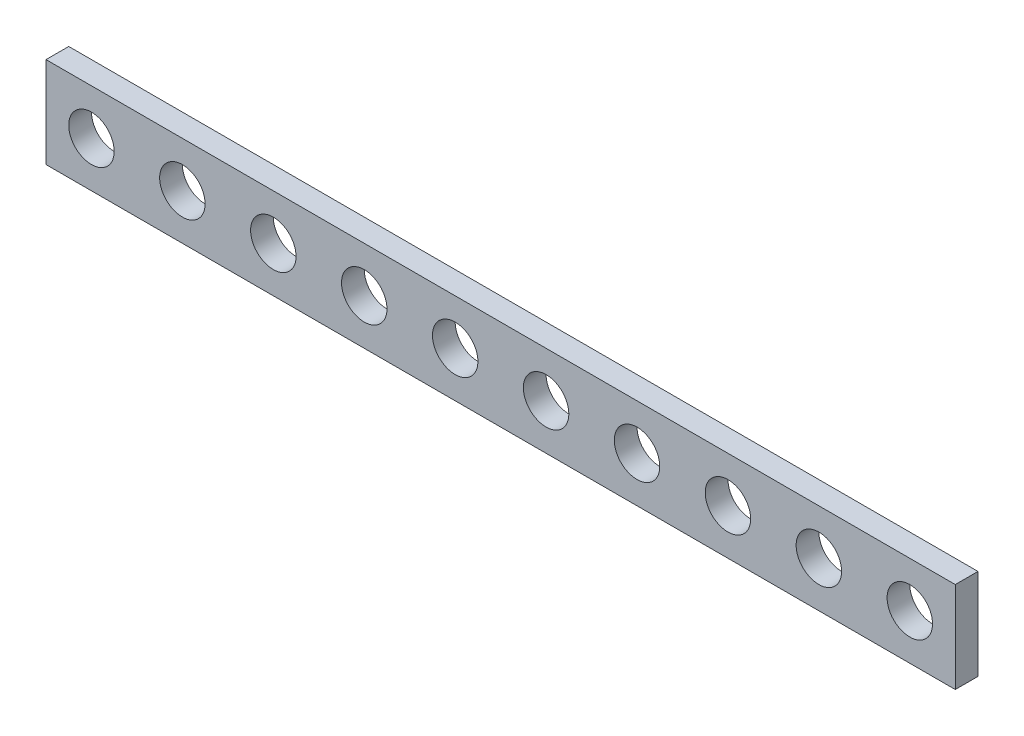
from build123d import *

# Parameters (mm, degrees)
SZKIC2_W                    = 200
SZKIC2_H                    = 20
SZKIC2_R                    = 5
DODANIE_WYCI_GNI_CIE5_DEPTH = 5
SZYK_LINIOWY1_OUTLINE_R     = 5
SZYK_LINIOWY1_DEPTH         = 5


# Read off the part's stored shape, not the designer's step: Szyk liniowy1
with BuildPart() as part:
    # Szkic2 → Dodanie-wyciągnięcie5 (new body)
    with BuildSketch(Plane.XY):
        with Locations((100, 10)):
            Rectangle(SZKIC2_W, SZKIC2_H)
        with Locations((10, 10)):
            Circle(SZKIC2_R, mode=Mode.SUBTRACT)
    extrude(amount=DODANIE_WYCI_GNI_CIE5_DEPTH)

    # Szyk liniowy1 outline → Szyk liniowy1 (cut)
    with BuildSketch(Plane.XY):
        with Locations((190, 10)):
            Circle(SZYK_LINIOWY1_OUTLINE_R)
        with Locations((170, 10)):
            Circle(SZYK_LINIOWY1_OUTLINE_R)
        with Locations((150, 10)):
            Circle(SZYK_LINIOWY1_OUTLINE_R)
        with Locations((130, 10)):
            Circle(SZYK_LINIOWY1_OUTLINE_R)
        with Locations((110, 10)):
            Circle(SZYK_LINIOWY1_OUTLINE_R)
        with Locations((90, 10)):
            Circle(SZYK_LINIOWY1_OUTLINE_R)
        with Locations((70, 10)):
            Circle(SZYK_LINIOWY1_OUTLINE_R)
        with Locations((50, 10)):
            Circle(SZYK_LINIOWY1_OUTLINE_R)
        with Locations((30, 10)):
            Circle(SZYK_LINIOWY1_OUTLINE_R)
    extrude(amount=SZYK_LINIOWY1_DEPTH, mode=Mode.SUBTRACT)


solid = part.part
